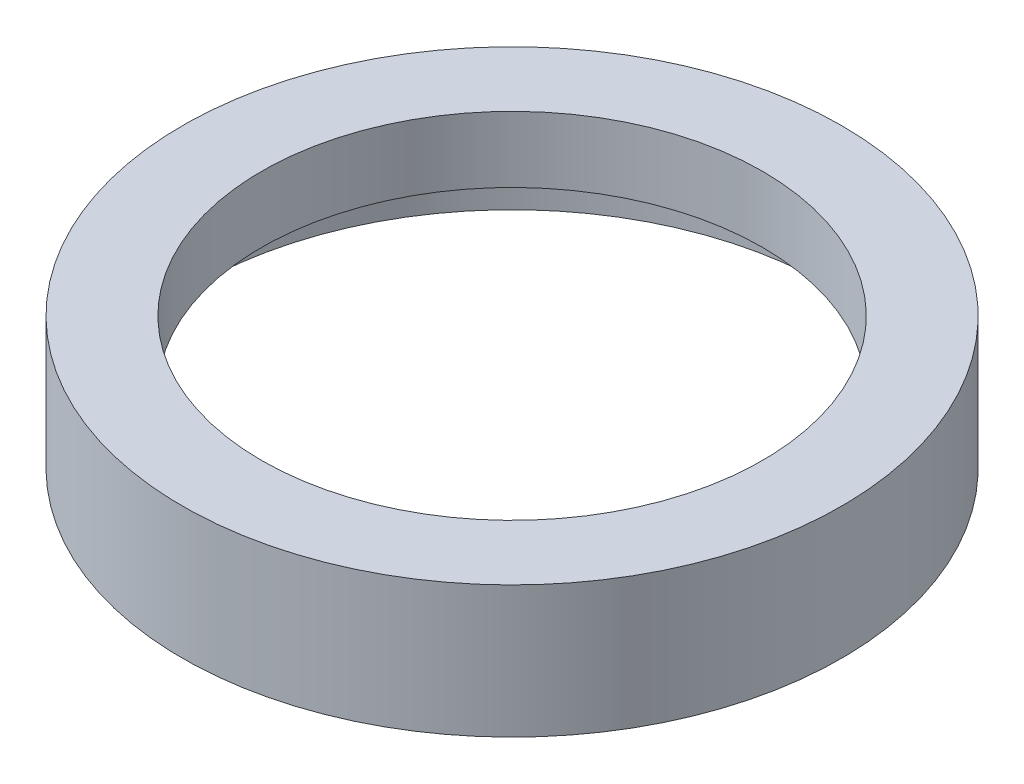
from build123d import *


with BuildPart() as part:
    # Sketch1 → Revolve1 (revolve)
    with BuildSketch(Plane.XY):
        Polygon((-158.75, 0), (-158.75, 63.5), (-120.65, 63.5), (-120.65, 31.75), (-127, 31.75), (-127, 57.15), (-152.4, 57.15), (-152.4, 0), align=None)
    revolve(axis=Axis((0, 0, 0), (0, 1, 0)))


solid = part.part
